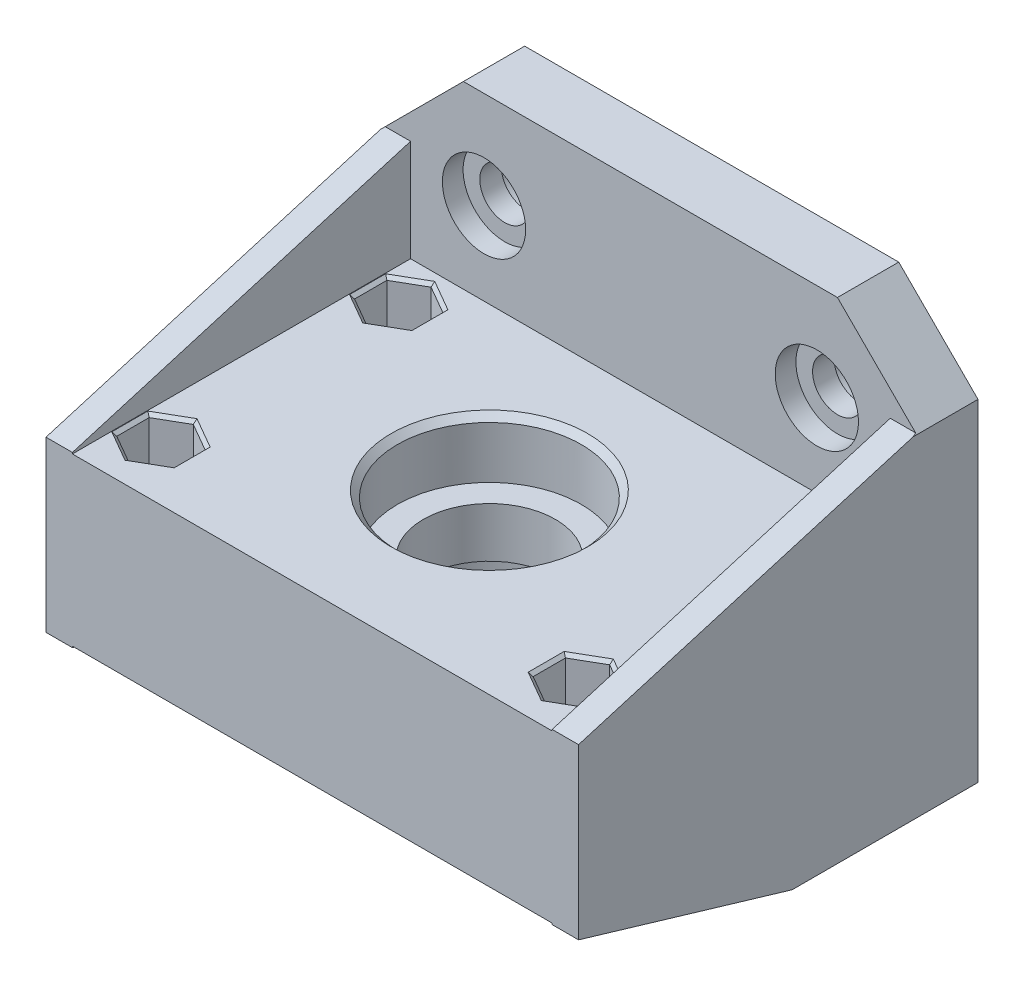
from build123d import *
from OCP.BRepFilletAPI import BRepFilletAPI_MakeChamfer

# Parameters (mm, degrees)
SKETCH1_W               = 64.008
SKETCH1_H               = 58.928
SKETCH1_R               = 3
SKETCH1_R_2             = 2.999999969
BOSS_EXTRUDE1_DEPTH     = 5.08
BOSS_EXTRUDE2_DEPTH     = 40.64
CHAMFER1_SIZE           = 40.64
CHAMFER1_SIZE_2         = 12.065
SKETCH3_R               = 7.9375
CUT_EXTRUDE1_DEPTH      = 40.64
SKETCH3_3_R             = 11.049
SKETCH3_3_R_2           = 7.9375
CUT_EXTRUDE2_DEPTH      = 7
FILLET1_SIZE            = 0.762
CUT_EXTRUDE3_DEPTH      = 6.35
SKETCH5_R               = 2.159
CUT_EXTRUDE4_DEPTH      = 25.4
CUT_EXTRUDE5_DEPTH      = 25.4
CUT_EXTRUDE5_DEPTH_BACK = 5.08
SKETCH6_R               = 5.08
CHAMFER2_SIZE           = 0.381
SKETCH7_R               = 5.0038
CUT_EXTRUDE6_DEPTH      = 2.4892
SKETCH10_W              = 64.008
SKETCH10_H              = 58.928
SKETCH10_R              = 4.191
BOSS_EXTRUDE3_DEPTH     = 2.286
BOSS_EXTRUDE4_DEPTH     = 8.89
CUT_EXTRUDE7_DEPTH      = 2.54
CUT_EXTRUDE8_DEPTH      = 65.783943597
CUT_EXTRUDE8_DEPTH_BACK = 65.783943597
SKETCH12_3_R            = 2.2225
CHAMFER3_SIZE           = 9.525
CHAMFER4_SIZE           = 0.9525


# Some blends are built 0.0001 mm under size
with BuildPart() as part:
    # Sketch1 → Boss-Extrude1 (new body)
    with BuildSketch(Plane.XY):
        Rectangle(SKETCH1_W, SKETCH1_H)
        with Locations((-20, 17.777206)):
            Circle(SKETCH1_R, mode=Mode.SUBTRACT)
        with Locations(Location((20, 17.777206, 0), (0, 0, 180))):
            Circle(SKETCH1_R, mode=Mode.SUBTRACT)
        with Locations((0, -19.560794)):
            Circle(SKETCH1_R_2, mode=Mode.SUBTRACT)
    extrude(amount=BOSS_EXTRUDE1_DEPTH)

    # Sketch2 → Boss-Extrude2 (add)
    with BuildSketch(Plane.XY.offset(5.08)):
        Polygon((-28.829, -12.1590054), (28.829, -12.1590054), (28.829, -24.3840054), (32.004, -24.3840054), (32.004, 20.0659946), (28.829, 20.0659946), (28.829, 7.8409946), (-28.829, 7.8409946), (-28.829, 20.0659946), (-32.004, 20.0659946), (-32.004, -24.3840054), (-28.829, -24.3840054), align=None)
    extrude(amount=BOSS_EXTRUDE2_DEPTH)

    # Chamfer1
    chamfer1_edges_1 = [part.edges().sort_by_distance(p)[0] for p in [
        (30.4165, -24.3840054, 45.72),
    ]]
    chamfer1_side_1 = [part.faces().sort_by_distance(p)[0] for p in [
        (30.4165, -24.3840054, 45.4787),
    ]]
    chamfer1_edges_2 = [part.edges().sort_by_distance(p)[0] for p in [
        (-30.4165, -24.3840054, 45.72),
    ]]
    chamfer1_side_2 = [part.faces().sort_by_distance(p)[0] for p in [
        (-30.4165, -24.3840054, 45.4787),
    ]]
    chamfer1_edges_3 = [part.edges().sort_by_distance(p)[0] for p in [
        (30.4165, 20.0659946, 45.72),
    ]]
    chamfer1_side_3 = [part.faces().sort_by_distance(p)[0] for p in [
        (30.4165, 20.0659946, 45.4787),
    ]]
    chamfer1_edges_4 = [part.edges().sort_by_distance(p)[0] for p in [
        (-30.4165, 20.0659946, 45.72),
    ]]
    chamfer1_side_4 = [part.faces().sort_by_distance(p)[0] for p in [
        (-30.4165, 20.0659946, 45.4787),
    ]]
    chamfer1 = BRepFilletAPI_MakeChamfer(part.part.solid().wrapped)
    for e in chamfer1_edges_1:
        chamfer1.Add(CHAMFER1_SIZE - 0.0001, CHAMFER1_SIZE_2 - 0.0001, e.wrapped, chamfer1_side_1[0].wrapped)
    for e in chamfer1_edges_2:
        chamfer1.Add(CHAMFER1_SIZE - 0.0001, CHAMFER1_SIZE_2 - 0.0001, e.wrapped, chamfer1_side_2[0].wrapped)
    for e in chamfer1_edges_3:
        chamfer1.Add(CHAMFER1_SIZE - 0.0001, CHAMFER1_SIZE_2 - 0.0001, e.wrapped, chamfer1_side_3[0].wrapped)
    for e in chamfer1_edges_4:
        chamfer1.Add(CHAMFER1_SIZE - 0.0001, CHAMFER1_SIZE_2 - 0.0001, e.wrapped, chamfer1_side_4[0].wrapped)
    add(Compound.cast(chamfer1.Shape()), mode=Mode.REPLACE)  # a hair under: the kernel refuses the full size

    # Sketch3 → Cut-Extrude1 (cut)
    with BuildSketch(Plane(origin=(0, 7.8409946, 0), x_dir=(1, 0, 0), z_dir=(0, 1, 0))):
        with Locations(Location((0, -24.4348, 0), (0, 0, 180))):
            Circle(SKETCH3_R)
    extrude(amount=-CUT_EXTRUDE1_DEPTH, mode=Mode.SUBTRACT)

    # Sketch3<3> → Cut-Extrude2 (cut)
    with BuildSketch(Plane(origin=(0, 7.8409946, 0), x_dir=(1, 0, 0), z_dir=(0, 1, 0))):
        with Locations(Location((0, -24.4348, 0), (0, 0, 180))):
            Circle(SKETCH3_3_R)
        with Locations(Location((0, -24.4348, 0), (0, 0, 180))):
            Circle(SKETCH3_3_R_2, mode=Mode.SUBTRACT)
    cut_extrude2 = extrude(amount=-CUT_EXTRUDE2_DEPTH, mode=Mode.SUBTRACT)

    # Mirror2: Cut-Extrude2 across plane
    add(cut_extrude2.mirror(Plane.ZX.offset(-2.1590054)), mode=Mode.SUBTRACT)

    # Fillet1
    fillet1_edges = [part.edges().sort_by_distance(p)[0] for p in [
        (11.049, 7.8409946, 24.4348),
        (11.049, -12.1590054, 24.4348),
    ]]
    chamfer(fillet1_edges, length=FILLET1_SIZE)

    # Sketch4 → Cut-Extrude3 (cut)
    with BuildSketch(Plane(origin=(0, 7.8409946, 0), x_dir=(1, 0, 0), z_dir=(0, 1, 0))):
        Polygon((-25.019, -14.196946317), (-21.6535, -12.253873986), (-21.6535, -8.367729324), (-25.019, -6.424656993), (-28.3845, -8.367729324), (-28.3845, -12.253873986), align=None)
        Polygon((-25.019, -42.771946317), (-21.6535, -40.828873986), (-21.6535, -36.942729324), (-25.019, -34.999656993), (-28.3845, -36.942729324), (-28.3845, -40.828873986), align=None)
        Polygon((28.3845, -40.828873986), (25.019, -42.771946317), (21.6535, -40.828873986), (21.6535, -36.942729324), (25.019, -34.999656993), (28.3845, -36.942729324), align=None)
        Polygon((28.3845, -12.253873986), (25.019, -14.196946317), (21.6535, -12.253873986), (21.6535, -8.367729324), (25.019, -6.424656993), (28.3845, -8.367729324), align=None)
    extrude(amount=-CUT_EXTRUDE3_DEPTH, mode=Mode.SUBTRACT)

    # Sketch5 → Cut-Extrude4 (cut)
    with BuildSketch(Plane(origin=(0, 1.4909946, 0), x_dir=(1, 0, 0), z_dir=(0, 1, 0))):
        with BuildLine():
            ThreePointArc((-22.86, -10.310801655), (-23.492356459, -8.784158114), (-25.019, -8.151801655))
            Line((-25.019, -8.151801655), (-25.019, -12.469801655))
            ThreePointArc((-25.019, -12.469801655), (-23.492356459, -11.837445196), (-22.86, -10.310801655))
        make_face()
        with BuildLine():
            Line((-25.019, -12.469801655), (-25.019, -8.151801655))
            ThreePointArc((-25.019, -8.151801655), (-27.178, -10.310801655), (-25.019, -12.469801655))
        make_face()
        with BuildLine():
            ThreePointArc((-23.149251153, -37.806301655), (-26.0985, -37.016052808), (-26.888748847, -39.965301655))
            Line((-26.888748847, -39.965301655), (-23.149251153, -37.806301655))
        make_face()
        with BuildLine():
            Line((-23.149251153, -37.806301655), (-26.888748847, -39.965301655))
            ThreePointArc((-26.888748847, -39.965301655), (-24.460209682, -40.971235514), (-22.86, -38.885801655))
            ThreePointArc((-22.86, -38.885801655), (-22.933566141, -38.327011337), (-23.149251153, -37.806301655))
        make_face()
        with Locations(Location((25.019, -10.310801655, 0), (0, 0, 270))):
            Circle(SKETCH5_R)
        with Locations(Location((25.019, -38.885801655, 0), (0, 0, 270))):
            Circle(SKETCH5_R)
    extrude(amount=-CUT_EXTRUDE4_DEPTH, mode=Mode.SUBTRACT)

    # Sketch6 → Cut-Extrude5 (cut, two sides: drawn at the far end of the back side and taken through both)
    with BuildSketch(Plane.XZ.offset(12.1590054).offset(-CUT_EXTRUDE5_DEPTH_BACK)):
        with Locations(Location((-25.019, 38.885801655, 0), (0, 0, 138.590377891))):
            Circle(SKETCH6_R)
        with Locations(Location((25.019, 38.885801655, 0), (0, 0, 41.409622109))):
            Circle(SKETCH6_R)
        with Locations(Location((25.019, 10.310801655, 0), (0, 0, 41.409622109))):
            Circle(SKETCH6_R)
        with Locations(Location((-25.019, 10.310801655, 0), (0, 0, 138.590377891))):
            Circle(SKETCH6_R)
    extrude(amount=CUT_EXTRUDE5_DEPTH + CUT_EXTRUDE5_DEPTH_BACK, mode=Mode.SUBTRACT)

    # Chamfer2
    chamfer2_edges = [part.edges().sort_by_distance(p)[0] for p in [
        (28.3845, 7.8409946, 10.310801655),
        (26.70175, 7.8409946, 7.396193159),
        (23.33625, 7.8409946, 7.396193159),
        (21.6535, 7.8409946, 10.310801655),
        (23.33625, 7.8409946, 13.225410152),
        (26.70175, 7.8409946, 13.225410152),
        (28.3845, 7.8409946, 38.885801655),
        (26.70175, 7.8409946, 35.971193159),
        (23.33625, 7.8409946, 35.971193159),
        (21.6535, 7.8409946, 38.885801655),
        (23.33625, 7.8409946, 41.800410152),
        (26.70175, 7.8409946, 41.800410152),
        (-26.70175, 7.8409946, 41.800410152),
        (-23.33625, 7.8409946, 41.800410152),
        (-21.6535, 7.8409946, 38.885801655),
        (-23.33625, 7.8409946, 35.971193159),
        (-26.70175, 7.8409946, 35.971193159),
        (-28.3845, 7.8409946, 38.885801655),
        (-26.70175, 7.8409946, 13.225410152),
        (-23.33625, 7.8409946, 13.225410152),
        (-21.6535, 7.8409946, 10.310801655),
        (-23.33625, 7.8409946, 7.396193159),
        (-26.70175, 7.8409946, 7.396193159),
        (-28.3845, 7.8409946, 10.310801655),
    ]]
    chamfer(chamfer2_edges, length=CHAMFER2_SIZE)

    # Sketch7 → Cut-Extrude6 (cut)
    with BuildSketch(Plane.XY.offset(5.08)):
        with Locations((-20, 17.777206)):
            Circle(SKETCH7_R)
        with Locations((20, 17.777206)):
            Circle(SKETCH7_R)
        with Locations((0, -19.560794)):
            Circle(SKETCH7_R)
    extrude(amount=-CUT_EXTRUDE6_DEPTH, mode=Mode.SUBTRACT)

    # Sketch10 → Boss-Extrude3 (add)
    with BuildSketch(Plane(origin=(0, 0, 0), x_dir=(-1, 0, 0), z_dir=(0, 0, -1))):
        Rectangle(SKETCH10_W, SKETCH10_H)
        with Locations((-20, 17.777206)):
            Circle(SKETCH10_R, mode=Mode.SUBTRACT)
        with Locations((20, 17.777206)):
            Circle(SKETCH10_R, mode=Mode.SUBTRACT)
        with Locations((0, -19.560794)):
            Circle(SKETCH10_R, mode=Mode.SUBTRACT)
    extrude(amount=BOSS_EXTRUDE3_DEPTH)

    # Sketch12 → Boss-Extrude4 (add)
    # profile 1 of 2: a face of its own
    with BuildSketch(Plane(origin=(0, 0, -2.286), x_dir=(-1, 0, 0), z_dir=(0, 0, -1))):
        Polygon((13.377704197, -14.854), (8.975408395, -22.479), (13.008200025, -29.464), (22.551799975, -29.464), (26.584591605, -22.479), (22.182295803, -14.854), align=None)
        Polygon((15.210791302, -26.929), (12.641582604, -22.479), (15.210791302, -18.029), (20.349208698, -18.029), (22.918417396, -22.479), (20.349208698, -26.929), align=None, mode=Mode.SUBTRACT)
    # profile 2 of 2: a face of its own
    with BuildSketch(Plane(origin=(0, 0, -2.286), x_dir=(-1, 0, 0), z_dir=(0, 0, -1))):
        Polygon((-22.551799975, -29.464), (-13.008200025, -29.464), (-8.975408395, -22.479), (-13.377704197, -14.854), (-22.182295803, -14.854), (-26.584591605, -22.479), align=None)
        Polygon((-20.349208698, -18.029), (-15.210791302, -18.029), (-12.641582604, -22.479), (-15.210791302, -26.929), (-20.349208698, -26.929), (-22.918417396, -22.479), align=None, mode=Mode.SUBTRACT)
    extrude(amount=-BOSS_EXTRUDE4_DEPTH)

    # Sketch13 → Cut-Extrude7 (cut)
    with BuildSketch(Plane.XY.offset(5.08)):
        Polygon((20.349208698, -26.929), (15.210791302, -26.929), (12.641582604, -22.479), (15.210791302, -18.029), (20.349208698, -18.029), (22.918417396, -22.479), align=None)
        Polygon((-15.210791302, -26.929), (-12.641582604, -22.479), (-15.210791302, -18.029), (-20.349208698, -18.029), (-22.918417396, -22.479), (-20.349208698, -26.929), align=None)
    extrude(amount=-CUT_EXTRUDE7_DEPTH, mode=Mode.SUBTRACT)

    # Sketch12<3> → Cut-Extrude8 (cut, two sides: drawn at the far end of the back side and taken through both)
    with BuildSketch(Plane(origin=(0, 0, -2.286), x_dir=(-1, 0, 0), z_dir=(0, 0, -1)).offset(-CUT_EXTRUDE8_DEPTH_BACK)):
        with Locations((17.78, -22.479)):
            Circle(SKETCH12_3_R)
        with Locations((-17.78, -22.479)):
            Circle(SKETCH12_3_R)
    extrude(amount=CUT_EXTRUDE8_DEPTH + CUT_EXTRUDE8_DEPTH_BACK, mode=Mode.SUBTRACT)

    # Chamfer3
    # the kernel refuses this chamfer: 9.525 mm, written as the material it takes off along each edge
    with BuildSketch(Plane(origin=(-32.004, -29.464, -26.78128046), x_dir=(-0.027495876610586386, 0.9996219169112968, 0), z_dir=(0, 0, 1)), Plane(origin=(-32.004, 29.464, 29.57528046), x_dir=(-0.027495876610586386, -0.9996219169112968, 0), z_dir=(0, 0, -1)), Plane(origin=(32.004, 29.464, 29.57528046), x_dir=(-0.9996219169112968, 0.027495876610586386, 0), z_dir=(0, 0, -1)), Plane(origin=(32.004, -29.464, 29.57528046), x_dir=(0.027495876610586386, 0.9996219169112968, 0), z_dir=(0, 0, -1))) as chamfer3_piece_1:
        Polygon((CHAMFER3_SIZE * 0.999621916911, -CHAMFER3_SIZE * 0.0274958766106), (-CHAMFER3_SIZE * 0.0274958766106, -CHAMFER3_SIZE * 0.999621916911), (0, 0), align=None)
    extrude(amount=56.356560921, mode=Mode.SUBTRACT)

    # Chamfer4
    # the kernel refuses this chamfer: 0.9525 mm, written as the material it takes off along each edge
    with BuildSketch(Plane(origin=(-24.631823849, -14.854, 6.604), x_dir=(0, 0.027495876610586414, -0.9996219169112968), z_dir=(1, 0, 0)), Plane(origin=(-27.809355628, -24.600353515, 6.604), x_dir=(-0.02381212764408986, 0.013747938305293018, -0.9996219169112968), z_dir=(0.5000000000000002, 0.8660254037844386, 0)), Plane(origin=(-14.60246822, -12.732646485, 6.604), x_dir=(0.023812127644090228, 0.013747938305293224, -0.9996219169112968), z_dir=(0.5000000000000001, -0.8660254037844387, 0))) as chamfer4_piece_1:
        Polygon((CHAMFER4_SIZE * 0.999621916911, -CHAMFER4_SIZE * 0.0274958766106), (-CHAMFER4_SIZE * 0.0274958766106, -CHAMFER4_SIZE * 0.999621916911), (0, 0), align=None)
    extrude(amount=13.703647697, mode=Mode.SUBTRACT)
    with BuildSketch(Plane(origin=(-10.558671979, -29.464, 6.604), x_dir=(0, -0.027495876610586386, -0.9996219169112968), z_dir=(-1, 0, 0)), Plane(origin=(24.928528046, -29.464, 6.604), x_dir=(0, -0.027495876610586386, -0.9996219169112968), z_dir=(-1, 0, 0))) as chamfer4_piece_2:
        Polygon((CHAMFER4_SIZE * 0.999621916911, -CHAMFER4_SIZE * 0.0274958766106), (-CHAMFER4_SIZE * 0.0274958766106, -CHAMFER4_SIZE * 0.999621916911), (0, 0), align=None)
    extrude(amount=14.369856067, mode=Mode.SUBTRACT)
    with BuildSketch(Plane(origin=(-7.750644372, -20.357646485, 6.604), x_dir=(0.02381212764409102, -0.013747938305293672, -0.9996219169112968), z_dir=(-0.49999999999999983, -0.8660254037844388, 0))) as chamfer4_piece_3:
        Polygon((CHAMFER4_SIZE * 0.999621916911, -CHAMFER4_SIZE * 0.0274958766106), (-CHAMFER4_SIZE * 0.0274958766106, -CHAMFER4_SIZE * 0.999621916911), (0, 0), align=None)
    extrude(amount=12.964639353, mode=Mode.SUBTRACT)
    with BuildSketch(Plane(origin=(-11.416818581, -24.600353515, 6.604), x_dir=(0.8656979742248805, 0.4998109584556481, 0.02749587661058634), z_dir=(-0.4999999999999997, 0.8660254037844388, 0))) as chamfer4_piece_4_section:
        Polygon((CHAMFER4_SIZE * 0.999621916911, CHAMFER4_SIZE * 0.0274958766106), (-CHAMFER4_SIZE * 0.0274958766106, CHAMFER4_SIZE * 0.999621916911), (0, 0), align=None)
    chamfer4_piece_4 = extrude(amount=10.037473488, mode=Mode.PRIVATE)
    chamfer4_piece_4 = split(chamfer4_piece_4, bisect_by=Plane(origin=(-11.869290737, -21.141351248, 6.282424482), z_dir=(-0.8660254037844386, 0.5000000000000001, 0)), keep=Keep.TOP, mode=Mode.PRIVATE)
    chamfer4_piece_4 = split(chamfer4_piece_4, bisect_by=Plane(origin=(-13.666207568, -18.029, 6.282424482), z_dir=(0, -1, 0)), keep=Keep.TOP, mode=Mode.PRIVATE)
    add(chamfer4_piece_4, mode=Mode.SUBTRACT)
    with BuildSketch(Plane(origin=(-16.435555325, -29.050353515, 6.604), x_dir=(0.8656979742248803, -0.4998109584556485, 0.02749587661058639), z_dir=(0.5000000000000001, 0.8660254037844386, 0))) as chamfer4_piece_5_section:
        Polygon((CHAMFER4_SIZE * 0.999621916911, CHAMFER4_SIZE * 0.0274958766106), (-CHAMFER4_SIZE * 0.0274958766106, CHAMFER4_SIZE * 0.999621916911), (0, 0), align=None)
    chamfer4_piece_5 = extrude(amount=10.037473488, mode=Mode.PRIVATE)
    chamfer4_piece_5 = split(chamfer4_piece_5, bisect_by=Plane(origin=(-11.869290737, -23.816648752, 6.282424482), z_dir=(-0.8660254037844388, -0.4999999999999997, 0)), keep=Keep.TOP, mode=Mode.PRIVATE)
    chamfer4_piece_5 = split(chamfer4_piece_5, bisect_by=Plane(origin=(-13.666207568, -26.929, 6.282424482), z_dir=(0, 1, 0)), keep=Keep.TOP, mode=Mode.PRIVATE)
    add(chamfer4_piece_5, mode=Mode.SUBTRACT)
    with BuildSketch(Plane(origin=(-22.798736744, -26.929, 6.604), x_dir=(0, -0.9996219169112968, 0.02749587661058636), z_dir=(1, 0, 0))) as chamfer4_piece_6_section:
        Polygon((CHAMFER4_SIZE * 0.999621916911, CHAMFER4_SIZE * 0.0274958766106), (-CHAMFER4_SIZE * 0.0274958766106, CHAMFER4_SIZE * 0.999621916911), (0, 0), align=None)
    chamfer4_piece_6 = extrude(amount=10.037473488, mode=Mode.PRIVATE)
    chamfer4_piece_6 = split(chamfer4_piece_6, bisect_by=Plane(origin=(-15.983083169, -28.266648752, 6.282424482), z_dir=(-0.8660254037844386, 0.5000000000000001, 0)), keep=Keep.TOP, mode=Mode.PRIVATE)
    chamfer4_piece_6 = split(chamfer4_piece_6, bisect_by=Plane(origin=(-19.576916831, -28.266648752, 6.282424482), z_dir=(0.8660254037844388, 0.4999999999999998, 0)), keep=Keep.TOP, mode=Mode.PRIVATE)
    add(chamfer4_piece_6, mode=Mode.SUBTRACT)
    with BuildSketch(Plane(origin=(-24.143181419, -20.357646485, 6.604), x_dir=(-0.8656979742248805, -0.4998109584556482, 0.027495876610586344), z_dir=(0.4999999999999998, -0.8660254037844388, 0))) as chamfer4_piece_7_section:
        Polygon((CHAMFER4_SIZE * 0.999621916911, CHAMFER4_SIZE * 0.0274958766106), (-CHAMFER4_SIZE * 0.0274958766106, CHAMFER4_SIZE * 0.999621916911), (0, 0), align=None)
    chamfer4_piece_7 = extrude(amount=10.037473488, mode=Mode.PRIVATE)
    chamfer4_piece_7 = split(chamfer4_piece_7, bisect_by=Plane(origin=(-21.893792432, -26.929, 6.282424482), z_dir=(0, 1, 0)), keep=Keep.TOP, mode=Mode.PRIVATE)
    chamfer4_piece_7 = split(chamfer4_piece_7, bisect_by=Plane(origin=(-23.690709263, -23.816648752, 6.282424482), z_dir=(0.8660254037844385, -0.5000000000000003, 0)), keep=Keep.TOP, mode=Mode.PRIVATE)
    add(chamfer4_piece_7, mode=Mode.SUBTRACT)
    with BuildSketch(Plane(origin=(-19.124444675, -15.907646485, 6.604), x_dir=(-0.8656979742248802, 0.49981095845564866, 0.027495876610586365), z_dir=(-0.5000000000000003, -0.8660254037844385, 0))) as chamfer4_piece_8_section:
        Polygon((CHAMFER4_SIZE * 0.999621916911, CHAMFER4_SIZE * 0.0274958766106), (-CHAMFER4_SIZE * 0.0274958766106, CHAMFER4_SIZE * 0.999621916911), (0, 0), align=None)
    chamfer4_piece_8 = extrude(amount=10.037473488, mode=Mode.PRIVATE)
    chamfer4_piece_8 = split(chamfer4_piece_8, bisect_by=Plane(origin=(-23.690709263, -21.141351248, 6.282424482), z_dir=(0.8660254037844388, 0.4999999999999998, 0)), keep=Keep.TOP, mode=Mode.PRIVATE)
    chamfer4_piece_8 = split(chamfer4_piece_8, bisect_by=Plane(origin=(-21.893792432, -18.029, 6.282424482), z_dir=(0, -1, 0)), keep=Keep.TOP, mode=Mode.PRIVATE)
    add(chamfer4_piece_8, mode=Mode.SUBTRACT)
    with BuildSketch(Plane(origin=(-12.761263256, -18.029, 6.604), x_dir=(0, 0.9996219169112968, 0.02749587661058636), z_dir=(-1, 0, 0))) as chamfer4_piece_9_section:
        Polygon((CHAMFER4_SIZE * 0.999621916911, CHAMFER4_SIZE * 0.0274958766106), (-CHAMFER4_SIZE * 0.0274958766106, CHAMFER4_SIZE * 0.999621916911), (0, 0), align=None)
    chamfer4_piece_9 = extrude(amount=10.037473488, mode=Mode.PRIVATE)
    chamfer4_piece_9 = split(chamfer4_piece_9, bisect_by=Plane(origin=(-15.983083169, -16.691351248, 6.282424482), z_dir=(-0.8660254037844388, -0.4999999999999997, 0)), keep=Keep.TOP, mode=Mode.PRIVATE)
    chamfer4_piece_9 = split(chamfer4_piece_9, bisect_by=Plane(origin=(-19.576916831, -16.691351248, 6.282424482), z_dir=(0.8660254037844385, -0.5000000000000003, 0)), keep=Keep.TOP, mode=Mode.PRIVATE)
    add(chamfer4_piece_9, mode=Mode.SUBTRACT)
    with BuildSketch(Plane(origin=(16.435555325, -15.907646485, 6.604), x_dir=(-0.8656979742248805, 0.4998109584556481, 0.027495876610586365), z_dir=(-0.4999999999999997, -0.8660254037844388, 0))) as chamfer4_piece_10_section:
        Polygon((CHAMFER4_SIZE * 0.999621916911, CHAMFER4_SIZE * 0.0274958766106), (-CHAMFER4_SIZE * 0.0274958766106, CHAMFER4_SIZE * 0.999621916911), (0, 0), align=None)
    chamfer4_piece_10 = extrude(amount=10.037473488, mode=Mode.PRIVATE)
    chamfer4_piece_10 = split(chamfer4_piece_10, bisect_by=Plane(origin=(13.666207568, -18.029, 6.282424482), z_dir=(0, -1, 0)), keep=Keep.TOP, mode=Mode.PRIVATE)
    chamfer4_piece_10 = split(chamfer4_piece_10, bisect_by=Plane(origin=(11.869290737, -21.141351248, 6.282424482), z_dir=(0.8660254037844386, 0.5000000000000001, 0)), keep=Keep.TOP, mode=Mode.PRIVATE)
    add(chamfer4_piece_10, mode=Mode.SUBTRACT)
    with BuildSketch(Plane(origin=(22.798736744, -18.029, 6.604), x_dir=(0, 0.9996219169112968, 0.02749587661058636), z_dir=(-1, 0, 0))) as chamfer4_piece_11_section:
        Polygon((CHAMFER4_SIZE * 0.999621916911, CHAMFER4_SIZE * 0.0274958766106), (-CHAMFER4_SIZE * 0.0274958766106, CHAMFER4_SIZE * 0.999621916911), (0, 0), align=None)
    chamfer4_piece_11 = extrude(amount=10.037473488, mode=Mode.PRIVATE)
    chamfer4_piece_11 = split(chamfer4_piece_11, bisect_by=Plane(origin=(15.983083169, -16.691351248, 6.282424482), z_dir=(0.8660254037844388, -0.4999999999999997, 0)), keep=Keep.TOP, mode=Mode.PRIVATE)
    chamfer4_piece_11 = split(chamfer4_piece_11, bisect_by=Plane(origin=(19.576916831, -16.691351248, 6.282424482), z_dir=(-0.8660254037844385, -0.5000000000000003, 0)), keep=Keep.TOP, mode=Mode.PRIVATE)
    add(chamfer4_piece_11, mode=Mode.SUBTRACT)
    with BuildSketch(Plane(origin=(24.143181419, -24.600353515, 6.604), x_dir=(0.8656979742248802, 0.49981095845564866, 0.02749587661058634), z_dir=(-0.5000000000000003, 0.8660254037844385, 0))) as chamfer4_piece_12_section:
        Polygon((CHAMFER4_SIZE * 0.999621916911, CHAMFER4_SIZE * 0.0274958766106), (-CHAMFER4_SIZE * 0.0274958766106, CHAMFER4_SIZE * 0.999621916911), (0, 0), align=None)
    chamfer4_piece_12 = extrude(amount=10.037473488, mode=Mode.PRIVATE)
    chamfer4_piece_12 = split(chamfer4_piece_12, bisect_by=Plane(origin=(21.893792432, -18.029, 6.282424482), z_dir=(0, -1, 0)), keep=Keep.TOP, mode=Mode.PRIVATE)
    chamfer4_piece_12 = split(chamfer4_piece_12, bisect_by=Plane(origin=(23.690709263, -21.141351248, 6.282424482), z_dir=(-0.8660254037844388, 0.4999999999999998, 0)), keep=Keep.TOP, mode=Mode.PRIVATE)
    add(chamfer4_piece_12, mode=Mode.SUBTRACT)
    with BuildSketch(Plane(origin=(19.124444675, -29.050353515, 6.604), x_dir=(0.8656979742248805, -0.4998109584556482, 0.027495876610586344), z_dir=(0.4999999999999998, 0.8660254037844388, 0))) as chamfer4_piece_13_section:
        Polygon((CHAMFER4_SIZE * 0.999621916911, CHAMFER4_SIZE * 0.0274958766106), (-CHAMFER4_SIZE * 0.0274958766106, CHAMFER4_SIZE * 0.999621916911), (0, 0), align=None)
    chamfer4_piece_13 = extrude(amount=10.037473488, mode=Mode.PRIVATE)
    chamfer4_piece_13 = split(chamfer4_piece_13, bisect_by=Plane(origin=(23.690709263, -23.816648752, 6.282424482), z_dir=(-0.8660254037844385, -0.5000000000000003, 0)), keep=Keep.TOP, mode=Mode.PRIVATE)
    chamfer4_piece_13 = split(chamfer4_piece_13, bisect_by=Plane(origin=(21.893792432, -26.929, 6.282424482), z_dir=(0, 1, 0)), keep=Keep.TOP, mode=Mode.PRIVATE)
    add(chamfer4_piece_13, mode=Mode.SUBTRACT)
    with BuildSketch(Plane(origin=(12.761263256, -26.929, 6.604), x_dir=(0, -0.9996219169112968, 0.02749587661058636), z_dir=(1, 0, 0))) as chamfer4_piece_14_section:
        Polygon((CHAMFER4_SIZE * 0.999621916911, CHAMFER4_SIZE * 0.0274958766106), (-CHAMFER4_SIZE * 0.0274958766106, CHAMFER4_SIZE * 0.999621916911), (0, 0), align=None)
    chamfer4_piece_14 = extrude(amount=10.037473488, mode=Mode.PRIVATE)
    chamfer4_piece_14 = split(chamfer4_piece_14, bisect_by=Plane(origin=(19.576916831, -28.266648752, 6.282424482), z_dir=(-0.8660254037844388, 0.4999999999999998, 0)), keep=Keep.TOP, mode=Mode.PRIVATE)
    chamfer4_piece_14 = split(chamfer4_piece_14, bisect_by=Plane(origin=(15.983083169, -28.266648752, 6.282424482), z_dir=(0.8660254037844386, 0.5000000000000001, 0)), keep=Keep.TOP, mode=Mode.PRIVATE)
    add(chamfer4_piece_14, mode=Mode.SUBTRACT)
    with BuildSketch(Plane(origin=(11.416818581, -20.357646485, 6.604), x_dir=(-0.8656979742248803, -0.4998109584556485, 0.02749587661058634), z_dir=(0.5000000000000001, -0.8660254037844386, 0))) as chamfer4_piece_15_section:
        Polygon((CHAMFER4_SIZE * 0.999621916911, CHAMFER4_SIZE * 0.0274958766106), (-CHAMFER4_SIZE * 0.0274958766106, CHAMFER4_SIZE * 0.999621916911), (0, 0), align=None)
    chamfer4_piece_15 = extrude(amount=10.037473488, mode=Mode.PRIVATE)
    chamfer4_piece_15 = split(chamfer4_piece_15, bisect_by=Plane(origin=(11.869290737, -23.816648752, 6.282424482), z_dir=(0.8660254037844388, -0.4999999999999997, 0)), keep=Keep.TOP, mode=Mode.PRIVATE)
    chamfer4_piece_15 = split(chamfer4_piece_15, bisect_by=Plane(origin=(13.666207568, -26.929, 6.282424482), z_dir=(0, 1, 0)), keep=Keep.TOP, mode=Mode.PRIVATE)
    add(chamfer4_piece_15, mode=Mode.SUBTRACT)
    with BuildSketch(Plane(origin=(14.232964048, -31.585353515, 6.604), x_dir=(0.8656979742248804, 0.4998109584556484, 0.027495876610586344), z_dir=(-0.5, 0.8660254037844387, 0))) as chamfer4_piece_16:
        Polygon((CHAMFER4_SIZE * 0.999621916911, CHAMFER4_SIZE * 0.0274958766106), (-CHAMFER4_SIZE * 0.0274958766106, CHAMFER4_SIZE * 0.999621916911), (0, 0), align=None)
    extrude(amount=12.964639353, mode=Mode.SUBTRACT)
    with BuildSketch(Plane(origin=(20.95753178, -12.732646485, 6.604), x_dir=(-0.8656979742248803, -0.4998109584556486, 0.02749587661058637), z_dir=(0.5000000000000002, -0.8660254037844386, 0)), Plane(origin=(10.928176151, -14.854, 6.604), x_dir=(0, -0.9996219169112968, 0.02749587661058636), z_dir=(1, 0, 0)), Plane(origin=(7.750644372, -24.600353515, 6.604), x_dir=(0.8656979742248803, -0.49981095845564844, 0.02749587661058634), z_dir=(0.5000000000000001, 0.8660254037844387, 0))) as chamfer4_piece_17:
        Polygon((CHAMFER4_SIZE * 0.999621916911, CHAMFER4_SIZE * 0.0274958766106), (-CHAMFER4_SIZE * 0.0274958766106, CHAMFER4_SIZE * 0.999621916911), (0, 0), align=None)
    extrude(amount=13.703647697, mode=Mode.SUBTRACT)
    with BuildSketch(Plane(origin=(27.809355628, -20.357646485, 6.604), x_dir=(0.023812127644091012, -0.013747938305293682, -0.9996219169112968), z_dir=(-0.5000000000000002, -0.8660254037844386, 0)), Plane(origin=(-21.426482567, -31.413106925, 6.604), x_dir=(-0.023812127644092157, -0.013747938305294348, -0.9996219169112968), z_dir=(-0.5000000000000003, 0.8660254037844385, 0))) as chamfer4_piece_18:
        Polygon((CHAMFER4_SIZE * 0.999621916911, -CHAMFER4_SIZE * 0.0274958766106), (-CHAMFER4_SIZE * 0.0274958766106, -CHAMFER4_SIZE * 0.999621916911), (0, 0), align=None)
    extrude(amount=12.765746123, mode=Mode.SUBTRACT)
    with BuildSketch(Plane(origin=(-16.435555325, -29.050353515, 6.604), x_dir=(0.8656979742248803, -0.4998109584556485, 0.02749587661058639), z_dir=(0.5000000000000001, 0.8660254037844386, 0))) as chamfer4_piece_19a_section:
        Polygon((CHAMFER4_SIZE * 0.999621916911, CHAMFER4_SIZE * 0.0274958766106), (-CHAMFER4_SIZE * 0.0274958766106, CHAMFER4_SIZE * 0.999621916911), (0, 0), align=None)
    chamfer4_piece_19a = extrude(amount=10.037473488, mode=Mode.PRIVATE)
    chamfer4_piece_19a = split(chamfer4_piece_19a, bisect_by=Plane(origin=(-12.782694622, -22.234586816, 6.296630691), z_dir=(0.8660254037844388, 0.4999999999999997, 0)), keep=Keep.TOP, mode=Mode.PRIVATE)
    with BuildSketch(Plane(origin=(-11.416818581, -24.600353515, 6.604), x_dir=(0.8656979742248805, 0.4998109584556481, 0.02749587661058634), z_dir=(-0.4999999999999997, 0.8660254037844388, 0))) as chamfer4_piece_19b_section:
        Polygon((CHAMFER4_SIZE * 0.999621916911, CHAMFER4_SIZE * 0.0274958766106), (-CHAMFER4_SIZE * 0.0274958766106, CHAMFER4_SIZE * 0.999621916911), (0, 0), align=None)
    chamfer4_piece_19b = extrude(amount=10.037473488, mode=Mode.PRIVATE)
    chamfer4_piece_19b = split(chamfer4_piece_19b, bisect_by=Plane(origin=(-12.782694622, -22.723413184, 6.296630691), z_dir=(0.8660254037844386, -0.5000000000000001, 0)), keep=Keep.TOP, mode=Mode.PRIVATE)
    chamfer4_piece_19 = chamfer4_piece_19a & chamfer4_piece_19b
    add(chamfer4_piece_19, mode=Mode.SUBTRACT)
    with BuildSketch(Plane(origin=(-11.416818581, -24.600353515, 6.604), x_dir=(0.8656979742248805, 0.4998109584556481, 0.02749587661058634), z_dir=(-0.4999999999999997, 0.8660254037844388, 0))) as chamfer4_piece_20a_section:
        Polygon((CHAMFER4_SIZE * 0.999621916911, CHAMFER4_SIZE * 0.0274958766106), (-CHAMFER4_SIZE * 0.0274958766106, CHAMFER4_SIZE * 0.999621916911), (0, 0), align=None)
    chamfer4_piece_20a = extrude(amount=10.037473488, mode=Mode.PRIVATE)
    chamfer4_piece_20a = split(chamfer4_piece_20a, bisect_by=Plane(origin=(-15.493015338, -18.029, 6.296630691), z_dir=(0, 1, 0)), keep=Keep.TOP, mode=Mode.PRIVATE)
    with BuildSketch(Plane(origin=(-12.761263256, -18.029, 6.604), x_dir=(0, 0.9996219169112968, 0.02749587661058636), z_dir=(-1, 0, 0))) as chamfer4_piece_20b_section:
        Polygon((CHAMFER4_SIZE * 0.999621916911, CHAMFER4_SIZE * 0.0274958766106), (-CHAMFER4_SIZE * 0.0274958766106, CHAMFER4_SIZE * 0.999621916911), (0, 0), align=None)
    chamfer4_piece_20b = extrude(amount=10.037473488, mode=Mode.PRIVATE)
    chamfer4_piece_20b = split(chamfer4_piece_20b, bisect_by=Plane(origin=(-15.069679284, -18.273413184, 6.296630691), z_dir=(0.8660254037844388, 0.4999999999999997, 0)), keep=Keep.TOP, mode=Mode.PRIVATE)
    chamfer4_piece_20 = chamfer4_piece_20a & chamfer4_piece_20b
    add(chamfer4_piece_20, mode=Mode.SUBTRACT)
    with BuildSketch(Plane(origin=(-16.435555325, -29.050353515, 6.604), x_dir=(0.8656979742248803, -0.4998109584556485, 0.02749587661058639), z_dir=(0.5000000000000001, 0.8660254037844386, 0))) as chamfer4_piece_21a_section:
        Polygon((CHAMFER4_SIZE * 0.999621916911, CHAMFER4_SIZE * 0.0274958766106), (-CHAMFER4_SIZE * 0.0274958766106, CHAMFER4_SIZE * 0.999621916911), (0, 0), align=None)
    chamfer4_piece_21a = extrude(amount=10.037473488, mode=Mode.PRIVATE)
    chamfer4_piece_21a = split(chamfer4_piece_21a, bisect_by=Plane(origin=(-15.493015338, -26.929, 6.296630691), z_dir=(0, -1, 0)), keep=Keep.TOP, mode=Mode.PRIVATE)
    with BuildSketch(Plane(origin=(-22.798736744, -26.929, 6.604), x_dir=(0, -0.9996219169112968, 0.02749587661058636), z_dir=(1, 0, 0))) as chamfer4_piece_21b_section:
        Polygon((CHAMFER4_SIZE * 0.999621916911, CHAMFER4_SIZE * 0.0274958766106), (-CHAMFER4_SIZE * 0.0274958766106, CHAMFER4_SIZE * 0.999621916911), (0, 0), align=None)
    chamfer4_piece_21b = extrude(amount=10.037473488, mode=Mode.PRIVATE)
    chamfer4_piece_21b = split(chamfer4_piece_21b, bisect_by=Plane(origin=(-15.069679284, -26.684586816, 6.296630691), z_dir=(0.8660254037844386, -0.5000000000000001, 0)), keep=Keep.TOP, mode=Mode.PRIVATE)
    chamfer4_piece_21 = chamfer4_piece_21a & chamfer4_piece_21b
    add(chamfer4_piece_21, mode=Mode.SUBTRACT)
    with BuildSketch(Plane(origin=(-22.798736744, -26.929, 6.604), x_dir=(0, -0.9996219169112968, 0.02749587661058636), z_dir=(1, 0, 0))) as chamfer4_piece_22a_section:
        Polygon((CHAMFER4_SIZE * 0.999621916911, CHAMFER4_SIZE * 0.0274958766106), (-CHAMFER4_SIZE * 0.0274958766106, CHAMFER4_SIZE * 0.999621916911), (0, 0), align=None)
    chamfer4_piece_22a = extrude(amount=10.037473488, mode=Mode.PRIVATE)
    chamfer4_piece_22a = split(chamfer4_piece_22a, bisect_by=Plane(origin=(-20.490320716, -26.684586816, 6.296630691), z_dir=(-0.8660254037844388, -0.4999999999999998, 0)), keep=Keep.TOP, mode=Mode.PRIVATE)
    with BuildSketch(Plane(origin=(-24.143181419, -20.357646485, 6.604), x_dir=(-0.8656979742248805, -0.4998109584556482, 0.027495876610586344), z_dir=(0.4999999999999998, -0.8660254037844388, 0))) as chamfer4_piece_22b_section:
        Polygon((CHAMFER4_SIZE * 0.999621916911, CHAMFER4_SIZE * 0.0274958766106), (-CHAMFER4_SIZE * 0.0274958766106, CHAMFER4_SIZE * 0.999621916911), (0, 0), align=None)
    chamfer4_piece_22b = extrude(amount=10.037473488, mode=Mode.PRIVATE)
    chamfer4_piece_22b = split(chamfer4_piece_22b, bisect_by=Plane(origin=(-20.066984662, -26.929, 6.296630691), z_dir=(0, -1, 0)), keep=Keep.TOP, mode=Mode.PRIVATE)
    chamfer4_piece_22 = chamfer4_piece_22a & chamfer4_piece_22b
    add(chamfer4_piece_22, mode=Mode.SUBTRACT)
    with BuildSketch(Plane(origin=(-24.143181419, -20.357646485, 6.604), x_dir=(-0.8656979742248805, -0.4998109584556482, 0.027495876610586344), z_dir=(0.4999999999999998, -0.8660254037844388, 0))) as chamfer4_piece_23a_section:
        Polygon((CHAMFER4_SIZE * 0.999621916911, CHAMFER4_SIZE * 0.0274958766106), (-CHAMFER4_SIZE * 0.0274958766106, CHAMFER4_SIZE * 0.999621916911), (0, 0), align=None)
    chamfer4_piece_23a = extrude(amount=10.037473488, mode=Mode.PRIVATE)
    chamfer4_piece_23a = split(chamfer4_piece_23a, bisect_by=Plane(origin=(-22.777305378, -22.234586816, 6.296630691), z_dir=(-0.8660254037844385, 0.5000000000000003, 0)), keep=Keep.TOP, mode=Mode.PRIVATE)
    with BuildSketch(Plane(origin=(-19.124444675, -15.907646485, 6.604), x_dir=(-0.8656979742248802, 0.49981095845564866, 0.027495876610586365), z_dir=(-0.5000000000000003, -0.8660254037844385, 0))) as chamfer4_piece_23b_section:
        Polygon((CHAMFER4_SIZE * 0.999621916911, CHAMFER4_SIZE * 0.0274958766106), (-CHAMFER4_SIZE * 0.0274958766106, CHAMFER4_SIZE * 0.999621916911), (0, 0), align=None)
    chamfer4_piece_23b = extrude(amount=10.037473488, mode=Mode.PRIVATE)
    chamfer4_piece_23b = split(chamfer4_piece_23b, bisect_by=Plane(origin=(-22.777305378, -22.723413184, 6.296630691), z_dir=(-0.8660254037844388, -0.4999999999999998, 0)), keep=Keep.TOP, mode=Mode.PRIVATE)
    chamfer4_piece_23 = chamfer4_piece_23a & chamfer4_piece_23b
    add(chamfer4_piece_23, mode=Mode.SUBTRACT)
    with BuildSketch(Plane(origin=(-12.761263256, -18.029, 6.604), x_dir=(0, 0.9996219169112968, 0.02749587661058636), z_dir=(-1, 0, 0))) as chamfer4_piece_24a_section:
        Polygon((CHAMFER4_SIZE * 0.999621916911, CHAMFER4_SIZE * 0.0274958766106), (-CHAMFER4_SIZE * 0.0274958766106, CHAMFER4_SIZE * 0.999621916911), (0, 0), align=None)
    chamfer4_piece_24a = extrude(amount=10.037473488, mode=Mode.PRIVATE)
    chamfer4_piece_24a = split(chamfer4_piece_24a, bisect_by=Plane(origin=(-20.490320716, -18.273413184, 6.296630691), z_dir=(-0.8660254037844385, 0.5000000000000003, 0)), keep=Keep.TOP, mode=Mode.PRIVATE)
    with BuildSketch(Plane(origin=(-19.124444675, -15.907646485, 6.604), x_dir=(-0.8656979742248802, 0.49981095845564866, 0.027495876610586365), z_dir=(-0.5000000000000003, -0.8660254037844385, 0))) as chamfer4_piece_24b_section:
        Polygon((CHAMFER4_SIZE * 0.999621916911, CHAMFER4_SIZE * 0.0274958766106), (-CHAMFER4_SIZE * 0.0274958766106, CHAMFER4_SIZE * 0.999621916911), (0, 0), align=None)
    chamfer4_piece_24b = extrude(amount=10.037473488, mode=Mode.PRIVATE)
    chamfer4_piece_24b = split(chamfer4_piece_24b, bisect_by=Plane(origin=(-20.066984662, -18.029, 6.296630691), z_dir=(0, 1, 0)), keep=Keep.TOP, mode=Mode.PRIVATE)
    chamfer4_piece_24 = chamfer4_piece_24a & chamfer4_piece_24b
    add(chamfer4_piece_24, mode=Mode.SUBTRACT)
    with BuildSketch(Plane(origin=(22.798736744, -18.029, 6.604), x_dir=(0, 0.9996219169112968, 0.02749587661058636), z_dir=(-1, 0, 0))) as chamfer4_piece_25a_section:
        Polygon((CHAMFER4_SIZE * 0.999621916911, CHAMFER4_SIZE * 0.0274958766106), (-CHAMFER4_SIZE * 0.0274958766106, CHAMFER4_SIZE * 0.999621916911), (0, 0), align=None)
    chamfer4_piece_25a = extrude(amount=10.037473488, mode=Mode.PRIVATE)
    chamfer4_piece_25a = split(chamfer4_piece_25a, bisect_by=Plane(origin=(15.069679284, -18.273413184, 6.296630691), z_dir=(-0.8660254037844388, 0.4999999999999997, 0)), keep=Keep.TOP, mode=Mode.PRIVATE)
    with BuildSketch(Plane(origin=(16.435555325, -15.907646485, 6.604), x_dir=(-0.8656979742248805, 0.4998109584556481, 0.027495876610586365), z_dir=(-0.4999999999999997, -0.8660254037844388, 0))) as chamfer4_piece_25b_section:
        Polygon((CHAMFER4_SIZE * 0.999621916911, CHAMFER4_SIZE * 0.0274958766106), (-CHAMFER4_SIZE * 0.0274958766106, CHAMFER4_SIZE * 0.999621916911), (0, 0), align=None)
    chamfer4_piece_25b = extrude(amount=10.037473488, mode=Mode.PRIVATE)
    chamfer4_piece_25b = split(chamfer4_piece_25b, bisect_by=Plane(origin=(15.493015338, -18.029, 6.296630691), z_dir=(0, 1, 0)), keep=Keep.TOP, mode=Mode.PRIVATE)
    chamfer4_piece_25 = chamfer4_piece_25a & chamfer4_piece_25b
    add(chamfer4_piece_25, mode=Mode.SUBTRACT)
    with BuildSketch(Plane(origin=(16.435555325, -15.907646485, 6.604), x_dir=(-0.8656979742248805, 0.4998109584556481, 0.027495876610586365), z_dir=(-0.4999999999999997, -0.8660254037844388, 0))) as chamfer4_piece_26a_section:
        Polygon((CHAMFER4_SIZE * 0.999621916911, CHAMFER4_SIZE * 0.0274958766106), (-CHAMFER4_SIZE * 0.0274958766106, CHAMFER4_SIZE * 0.999621916911), (0, 0), align=None)
    chamfer4_piece_26a = extrude(amount=10.037473488, mode=Mode.PRIVATE)
    chamfer4_piece_26a = split(chamfer4_piece_26a, bisect_by=Plane(origin=(12.782694622, -22.723413184, 6.296630691), z_dir=(-0.8660254037844386, -0.5000000000000001, 0)), keep=Keep.TOP, mode=Mode.PRIVATE)
    with BuildSketch(Plane(origin=(11.416818581, -20.357646485, 6.604), x_dir=(-0.8656979742248803, -0.4998109584556485, 0.02749587661058634), z_dir=(0.5000000000000001, -0.8660254037844386, 0))) as chamfer4_piece_26b_section:
        Polygon((CHAMFER4_SIZE * 0.999621916911, CHAMFER4_SIZE * 0.0274958766106), (-CHAMFER4_SIZE * 0.0274958766106, CHAMFER4_SIZE * 0.999621916911), (0, 0), align=None)
    chamfer4_piece_26b = extrude(amount=10.037473488, mode=Mode.PRIVATE)
    chamfer4_piece_26b = split(chamfer4_piece_26b, bisect_by=Plane(origin=(12.782694622, -22.234586816, 6.296630691), z_dir=(-0.8660254037844388, 0.4999999999999997, 0)), keep=Keep.TOP, mode=Mode.PRIVATE)
    chamfer4_piece_26 = chamfer4_piece_26a & chamfer4_piece_26b
    add(chamfer4_piece_26, mode=Mode.SUBTRACT)
    with BuildSketch(Plane(origin=(22.798736744, -18.029, 6.604), x_dir=(0, 0.9996219169112968, 0.02749587661058636), z_dir=(-1, 0, 0))) as chamfer4_piece_27a_section:
        Polygon((CHAMFER4_SIZE * 0.999621916911, CHAMFER4_SIZE * 0.0274958766106), (-CHAMFER4_SIZE * 0.0274958766106, CHAMFER4_SIZE * 0.999621916911), (0, 0), align=None)
    chamfer4_piece_27a = extrude(amount=10.037473488, mode=Mode.PRIVATE)
    chamfer4_piece_27a = split(chamfer4_piece_27a, bisect_by=Plane(origin=(20.490320716, -18.273413184, 6.296630691), z_dir=(0.8660254037844385, 0.5000000000000003, 0)), keep=Keep.TOP, mode=Mode.PRIVATE)
    with BuildSketch(Plane(origin=(24.143181419, -24.600353515, 6.604), x_dir=(0.8656979742248802, 0.49981095845564866, 0.02749587661058634), z_dir=(-0.5000000000000003, 0.8660254037844385, 0))) as chamfer4_piece_27b_section:
        Polygon((CHAMFER4_SIZE * 0.999621916911, CHAMFER4_SIZE * 0.0274958766106), (-CHAMFER4_SIZE * 0.0274958766106, CHAMFER4_SIZE * 0.999621916911), (0, 0), align=None)
    chamfer4_piece_27b = extrude(amount=10.037473488, mode=Mode.PRIVATE)
    chamfer4_piece_27b = split(chamfer4_piece_27b, bisect_by=Plane(origin=(20.066984662, -18.029, 6.296630691), z_dir=(0, 1, 0)), keep=Keep.TOP, mode=Mode.PRIVATE)
    chamfer4_piece_27 = chamfer4_piece_27a & chamfer4_piece_27b
    add(chamfer4_piece_27, mode=Mode.SUBTRACT)
    with BuildSketch(Plane(origin=(24.143181419, -24.600353515, 6.604), x_dir=(0.8656979742248802, 0.49981095845564866, 0.02749587661058634), z_dir=(-0.5000000000000003, 0.8660254037844385, 0))) as chamfer4_piece_28a_section:
        Polygon((CHAMFER4_SIZE * 0.999621916911, CHAMFER4_SIZE * 0.0274958766106), (-CHAMFER4_SIZE * 0.0274958766106, CHAMFER4_SIZE * 0.999621916911), (0, 0), align=None)
    chamfer4_piece_28a = extrude(amount=10.037473488, mode=Mode.PRIVATE)
    chamfer4_piece_28a = split(chamfer4_piece_28a, bisect_by=Plane(origin=(22.777305378, -22.723413184, 6.296630691), z_dir=(0.8660254037844388, -0.4999999999999998, 0)), keep=Keep.TOP, mode=Mode.PRIVATE)
    with BuildSketch(Plane(origin=(19.124444675, -29.050353515, 6.604), x_dir=(0.8656979742248805, -0.4998109584556482, 0.027495876610586344), z_dir=(0.4999999999999998, 0.8660254037844388, 0))) as chamfer4_piece_28b_section:
        Polygon((CHAMFER4_SIZE * 0.999621916911, CHAMFER4_SIZE * 0.0274958766106), (-CHAMFER4_SIZE * 0.0274958766106, CHAMFER4_SIZE * 0.999621916911), (0, 0), align=None)
    chamfer4_piece_28b = extrude(amount=10.037473488, mode=Mode.PRIVATE)
    chamfer4_piece_28b = split(chamfer4_piece_28b, bisect_by=Plane(origin=(22.777305378, -22.234586816, 6.296630691), z_dir=(0.8660254037844385, 0.5000000000000003, 0)), keep=Keep.TOP, mode=Mode.PRIVATE)
    chamfer4_piece_28 = chamfer4_piece_28a & chamfer4_piece_28b
    add(chamfer4_piece_28, mode=Mode.SUBTRACT)
    with BuildSketch(Plane(origin=(19.124444675, -29.050353515, 6.604), x_dir=(0.8656979742248805, -0.4998109584556482, 0.027495876610586344), z_dir=(0.4999999999999998, 0.8660254037844388, 0))) as chamfer4_piece_29a_section:
        Polygon((CHAMFER4_SIZE * 0.999621916911, CHAMFER4_SIZE * 0.0274958766106), (-CHAMFER4_SIZE * 0.0274958766106, CHAMFER4_SIZE * 0.999621916911), (0, 0), align=None)
    chamfer4_piece_29a = extrude(amount=10.037473488, mode=Mode.PRIVATE)
    chamfer4_piece_29a = split(chamfer4_piece_29a, bisect_by=Plane(origin=(20.066984662, -26.929, 6.296630691), z_dir=(0, -1, 0)), keep=Keep.TOP, mode=Mode.PRIVATE)
    with BuildSketch(Plane(origin=(12.761263256, -26.929, 6.604), x_dir=(0, -0.9996219169112968, 0.02749587661058636), z_dir=(1, 0, 0))) as chamfer4_piece_29b_section:
        Polygon((CHAMFER4_SIZE * 0.999621916911, CHAMFER4_SIZE * 0.0274958766106), (-CHAMFER4_SIZE * 0.0274958766106, CHAMFER4_SIZE * 0.999621916911), (0, 0), align=None)
    chamfer4_piece_29b = extrude(amount=10.037473488, mode=Mode.PRIVATE)
    chamfer4_piece_29b = split(chamfer4_piece_29b, bisect_by=Plane(origin=(20.490320716, -26.684586816, 6.296630691), z_dir=(0.8660254037844388, -0.4999999999999998, 0)), keep=Keep.TOP, mode=Mode.PRIVATE)
    chamfer4_piece_29 = chamfer4_piece_29a & chamfer4_piece_29b
    add(chamfer4_piece_29, mode=Mode.SUBTRACT)
    with BuildSketch(Plane(origin=(11.416818581, -20.357646485, 6.604), x_dir=(-0.8656979742248803, -0.4998109584556485, 0.02749587661058634), z_dir=(0.5000000000000001, -0.8660254037844386, 0))) as chamfer4_piece_30a_section:
        Polygon((CHAMFER4_SIZE * 0.999621916911, CHAMFER4_SIZE * 0.0274958766106), (-CHAMFER4_SIZE * 0.0274958766106, CHAMFER4_SIZE * 0.999621916911), (0, 0), align=None)
    chamfer4_piece_30a = extrude(amount=10.037473488, mode=Mode.PRIVATE)
    chamfer4_piece_30a = split(chamfer4_piece_30a, bisect_by=Plane(origin=(15.493015338, -26.929, 6.296630691), z_dir=(0, -1, 0)), keep=Keep.TOP, mode=Mode.PRIVATE)
    with BuildSketch(Plane(origin=(12.761263256, -26.929, 6.604), x_dir=(0, -0.9996219169112968, 0.02749587661058636), z_dir=(1, 0, 0))) as chamfer4_piece_30b_section:
        Polygon((CHAMFER4_SIZE * 0.999621916911, CHAMFER4_SIZE * 0.0274958766106), (-CHAMFER4_SIZE * 0.0274958766106, CHAMFER4_SIZE * 0.999621916911), (0, 0), align=None)
    chamfer4_piece_30b = extrude(amount=10.037473488, mode=Mode.PRIVATE)
    chamfer4_piece_30b = split(chamfer4_piece_30b, bisect_by=Plane(origin=(15.069679284, -26.684586816, 6.296630691), z_dir=(-0.8660254037844386, -0.5000000000000001, 0)), keep=Keep.TOP, mode=Mode.PRIVATE)
    chamfer4_piece_30 = chamfer4_piece_30a & chamfer4_piece_30b
    add(chamfer4_piece_30, mode=Mode.SUBTRACT)


solid = part.part
